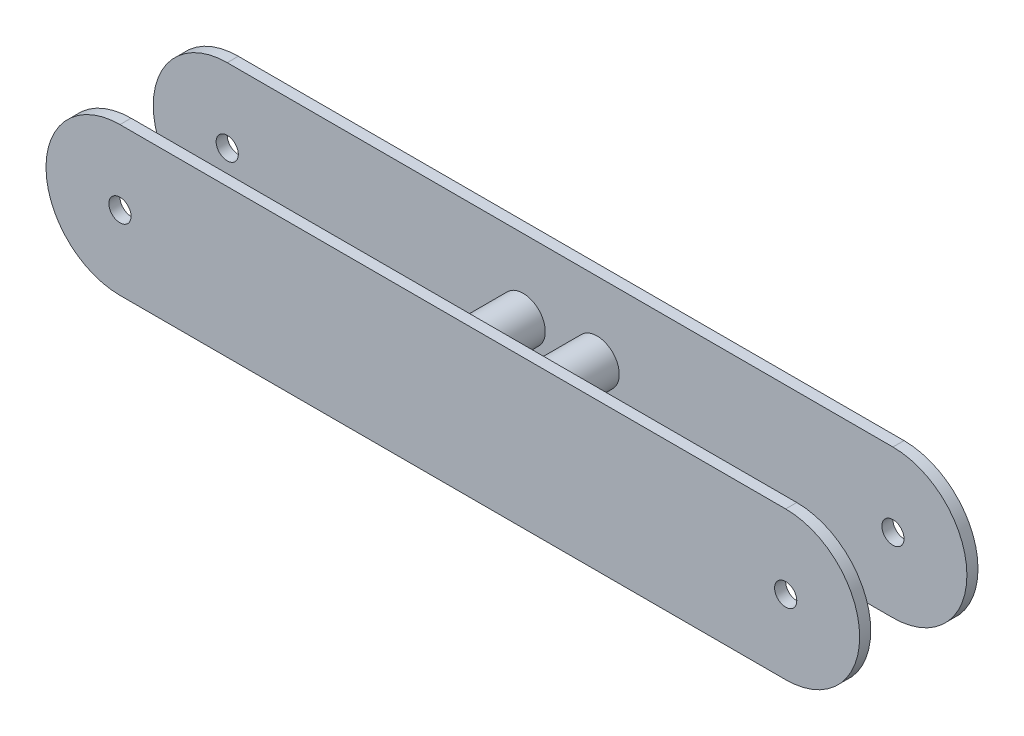
from build123d import *

# Parameters (mm, degrees)
BOSS_EXTRUDE2_DEPTH = 16
SKETCH2_R           = 1.5
CUT_EXTRUDE1_DEPTH  = 16
SKETCH3_W           = 110.03675272
SKETCH3_H           = 13
CUT_EXTRUDE2_DEPTH  = 23
SKETCH4_R           = 3
BOSS_EXTRUDE3_DEPTH = 16


with BuildPart() as part:
    # Sketch1 → Boss-Extrude2 (new body)
    with BuildSketch(Plane.XY):
        with BuildLine():
            Line((86.254873389, 2.099543411), (-3.745126611, 2.099543411))
            ThreePointArc((-3.745126611, 2.099543411), (-13.745126611, -7.900456589), (-3.745126611, -17.900456589))
            Line((-3.745126611, -17.900456589), (86.254873389, -17.900456589))
            ThreePointArc((86.254873389, -17.900456589), (96.254873389, -7.900456589), (86.254873389, 2.099543411))
        make_face()
    extrude(amount=BOSS_EXTRUDE2_DEPTH)

    # Sketch2 → Cut-Extrude1 (cut)
    with BuildSketch(Plane.XY.offset(16)):
        with Locations((-3.745126611, -7.900456589)):
            Circle(SKETCH2_R)
        with Locations((86.254873389, -7.900456589)):
            Circle(SKETCH2_R)
    extrude(amount=-CUT_EXTRUDE1_DEPTH, mode=Mode.SUBTRACT)

    # Sketch3 → Cut-Extrude2 (cut)
    with BuildSketch(Plane(origin=(0, 2.099543411, 0), x_dir=(1, 0, 0), z_dir=(0, 1, 0))):
        with Locations((41.257830101, -8)):
            Rectangle(SKETCH3_W, SKETCH3_H)
    extrude(amount=-CUT_EXTRUDE2_DEPTH, mode=Mode.SUBTRACT)


with BuildPart() as cut_extrude2_piece_1:
    # of the separate pieces the step leaves, piece 1, a body of its own (cut_extrude2_pieces)
    add(part.part.solids().sort_by_distance((86.254873389, 2.099543411, 14.5))[0])



with BuildPart() as cut_extrude2_piece_2:
    # of the separate pieces the step leaves, piece 2, a body of its own (cut_extrude2_pieces)
    add(part.part.solids().sort_by_distance((86.254873389, -17.900456589, 0))[0])


with BuildPart() as cut_extrude2_piece_1_1:
    add(cut_extrude2_piece_1.part)

    add(cut_extrude2_piece_2.part)  # Boss-Extrude3 merges Cut-Extrude2 piece 2
    # Sketch4 → Boss-Extrude3 (add)
    with BuildSketch(Plane(origin=(0, 0, 0), x_dir=(-1, 0, 0), z_dir=(0, 0, -1))):
        with Locations((-36.254873389, -7.900456589)):
            Circle(SKETCH4_R)
        with Locations((-46.254873389, -7.900456589)):
            Circle(SKETCH4_R)
    extrude(amount=-BOSS_EXTRUDE3_DEPTH)


solid = cut_extrude2_piece_1_1.part
